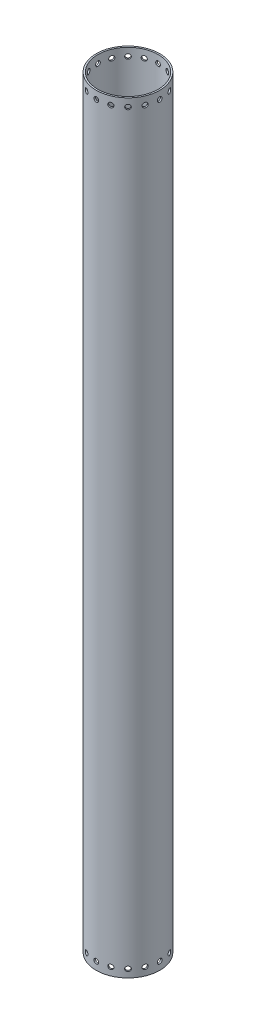
from build123d import *

# Parameters (mm, degrees)
SKETCH1_R                    = 63.5
SKETCH1_R_2                  = 60.325
BOSS_EXTRUDE1_DEPTH          = 1524
F_3_8_0_375_DIAMETER_HOLE1_D = 9.525
CIRPATTERN1_COUNT            = 16
F_3_8_0_375_DIAMETER_HOLE2_D = 9.525
CIRPATTERN2_COUNT            = 16


with BuildPart() as part:
    # Sketch1 → Boss-Extrude1 (new body)
    with BuildSketch(Plane(origin=(0, 0, 0), x_dir=(1, 0, 0), z_dir=(0, 1, 0))):
        Circle(SKETCH1_R)
        Circle(SKETCH1_R_2, mode=Mode.SUBTRACT)
    extrude(amount=BOSS_EXTRUDE1_DEPTH)

    # 3/8 (0.375) Diameter Hole1 (through all)
    with Locations(Plane.XY.offset(63.5)):
        with Locations((0, 15.875)):
            f_3_8_0_375_diameter_hole1 = Hole(F_3_8_0_375_DIAMETER_HOLE1_D / 2)

    # CirPattern1: 3/8 (0.375) Diameter Hole1 ×16 about axis
    cirpattern1_axis = Axis((0, 0, 0), (0, 1, 0))
    for i in range(1, CIRPATTERN1_COUNT):
        add(f_3_8_0_375_diameter_hole1.rotate(cirpattern1_axis, i * 360 / CIRPATTERN1_COUNT), mode=Mode.SUBTRACT)

    # 3/8 (0.375) Diameter Hole2 (through all)
    with Locations(Plane.XY.offset(63.5)):
        with Locations((0, 1508.125)):
            f_3_8_0_375_diameter_hole2 = Hole(F_3_8_0_375_DIAMETER_HOLE2_D / 2)

    # CirPattern2: 3/8 (0.375) Diameter Hole2 ×16 about axis
    cirpattern2_axis = Axis((0, 0, 0), (0, 1, 0))
    for i in range(1, CIRPATTERN2_COUNT):
        add(f_3_8_0_375_diameter_hole2.rotate(cirpattern2_axis, i * 360 / CIRPATTERN2_COUNT), mode=Mode.SUBTRACT)


solid = part.part
